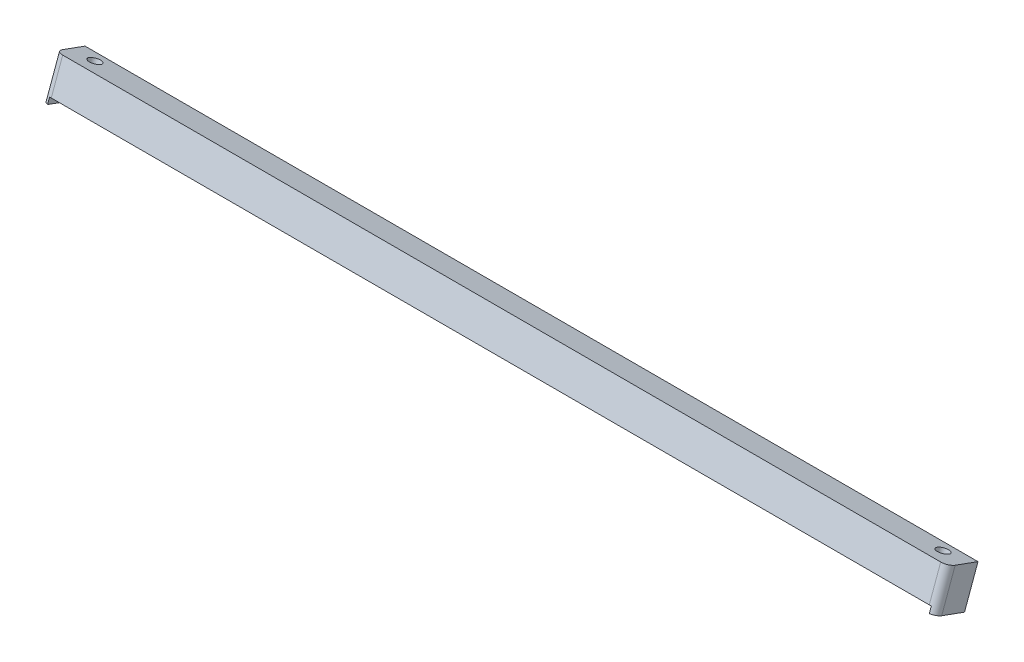
from build123d import *

# Parameters (mm, degrees)
BOSS_EXTRUDE1_DEPTH = 239
SKETCH2_R           = 1.5999999999999908
SKETCH2_R_2         = 1.599999999999998
CUT_EXTRUDE1_DEPTH  = 240.44586691023747
BOSS_EXTRUDE2_DEPTH = 1.6
FILLET1_R           = 2
SKETCH4_W           = 302.77939153503445
SKETCH4_H           = 48.73306397089993
CUT_EXTRUDE2_DEPTH  = 0.55


with BuildPart() as part:
    # Sketch1 → Boss-Extrude1 (new body)
    with BuildSketch(Plane(origin=(0, 0, 0), x_dir=(0, 0, -1), z_dir=(1, 0, 0))):
        Polygon((2.5431313581277277, 8.378511762801937), (-0.1315705594718698, 1.029828640425271), (-8.118957836152065, 3.936999858693529), (-4.86976647455813, 12.864079756159628), (3.117620802122064, 9.95690853789137), align=None)
    extrude(amount=BOSS_EXTRUDE1_DEPTH)

    # Sketch2 → Cut-Extrude1 (cut, through all)
    with BuildSketch(Plane(origin=(0, 9.794155508645982, -3.5647810749215956), x_dir=(1, 0, 0), z_dir=(0, 0.9396926207859053, -0.3420201433256773))):
        with Locations((232.99999999999997, -4.047641310446725)):
            Circle(SKETCH2_R)
        with Locations((5.999999999999991, -4.047641310446752)):
            Circle(SKETCH2_R_2)
    extrude(amount=-CUT_EXTRUDE1_DEPTH, mode=Mode.SUBTRACT)

    # Sketch3 → Boss-Extrude2 (add)
    with BuildSketch(Plane(origin=(0, 0.8670756111798825, -0.31558971332766134), x_dir=(1, 0, 0), z_dir=(0, 0.9396926207859052, -0.34202014332567726))):
        Polygon((0, -0.47585802304752833), (1.5, -0.47585802304752783), (1.5000000000000013, -8.975858023047525), (0, -8.975858023047529), align=None)
        Polygon((239, -0.47585802304752833), (237.5, -0.475858023047528), (237.5, -8.975858023047525), (239, -8.975858023047529), align=None)
    extrude(amount=-BOSS_EXTRUDE2_DEPTH)

    # Fillet1
    fillet1_edges = [part.edges().sort_by_distance(p)[0] for p in [
        (239, 7.6487857107978545, 6.76797827001564),
        (0, 7.648785710797854, 6.76797827001564),
    ]]
    fillet(fillet1_edges, radius=FILLET1_R)

    # Sketch4 → Cut-Extrude2 (cut)
    with BuildSketch(Plane(origin=(0, 9.794155508645986, -3.5647810749215965), x_dir=(1, 0, 0), z_dir=(0, 0.9396926207859053, -0.34202014332567743))):
        with Locations((120.43717430713222, 0.7530071571181338)):
            Rectangle(SKETCH4_W, SKETCH4_H)
    extrude(amount=-CUT_EXTRUDE2_DEPTH, mode=Mode.SUBTRACT)


solid = part.part
